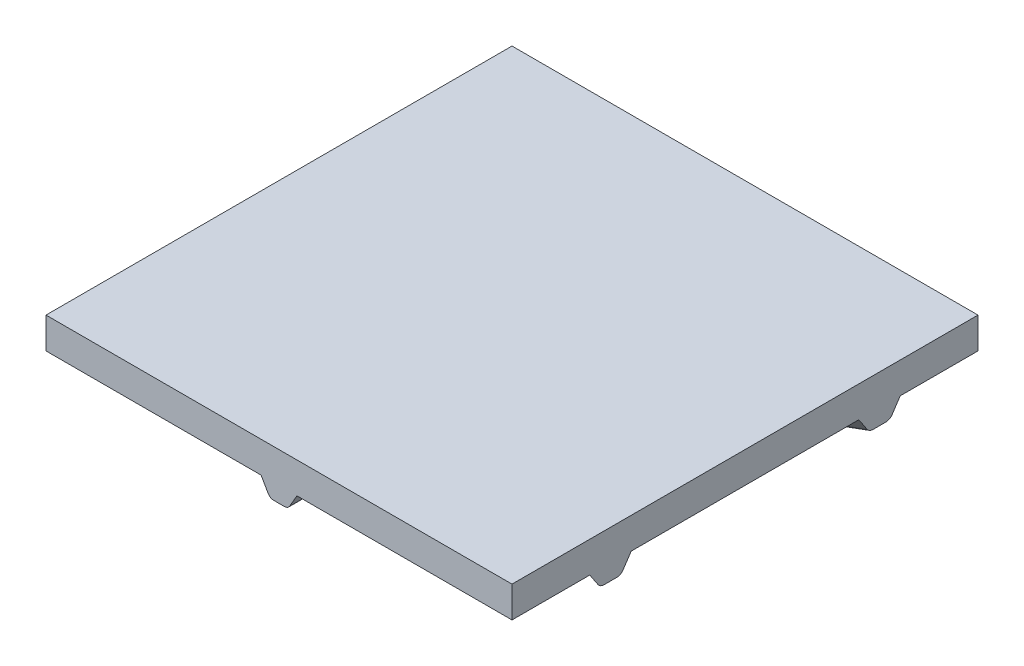
from build123d import *

# Parameters (mm, degrees)
HEXAGON_DEPTH = 20
HEXAGON_DRAFT = -20.000000000000043
BASE_DEPTH    = 10
SMALL_DEPTH   = 75
FILLET_2_R    = 3
ARRAY_START   = -102.451905284
ARRAY_DEPTH   = 204.903810568
ARRAY_2_DEPTH = 204.903810568
ARRAY_START_2 = 45.459553514
ARRAY_3_DEPTH = 29.540446486
FILLET2_R     = 2
CROQUIS4_W    = 26.916537621276092
CROQUIS4_H    = 24.058782859612524
CROQUIS4_W_2  = 36.99619518821565
CROQUIS4_H_2  = 32.17850701075816
TRIM_DEPTH    = 179.30560151606045


# Read off the part's stored shape, not the designer's step: array
with BuildPart() as part:
    # Croquis1 → hexagon (with draft: the straight prism first)
    with BuildSketch(Plane(origin=(0, 0, 0), x_dir=(1, 0, 0), z_dir=(0, 1, 0))):
        Polygon((46.18802153516988, 0), (23.09401076758485, 39.9999999999999), (-23.09401076758513, 39.99999999999974), (-46.18802153516988, -3.2253e-13), (-23.09401076758457, -40.00000000000006), (23.09401076758541, -39.99999999999958), align=None)
    extrude(amount=HEXAGON_DEPTH)
    # hexagon: the draft: its side faces are tilted about the plane it starts from
    hexagon_sides = [part.faces().sort_by_distance(p)[0] for p in [
        (34.641016151, 10, -20),
        (0, 10, -40),
        (-34.641016151, 10, -20),
        (-34.641016151, 10, 20),
        (0, 10, 40),
        (34.641016151, 10, 20),
    ]]
    draft(hexagon_sides, Plane(origin=(0, 0, 0), x_dir=(1, 0, 0), z_dir=(0, 1, 0)), HEXAGON_DRAFT)

    # Croquis2 → base (add)
    with BuildSketch(Plane(origin=(0, 20, 0), x_dir=(1, 0, 0), z_dir=(0, 1, 0))):
        Polygon((74.99999999999999, -74.99999999999999), (-75.00000000000001, -75.00000000000001), (-75.00000000000001, 74.99999999999999), (74.99999999999999, 75.00000000000001), align=None)
    extrude(amount=BASE_DEPTH)

    # Croquis3 → small (add, through all)
    with BuildSketch(Plane.XY):
        Polygon((-5.773502691896257, 20), (-2.886751345948127, 15), (2.886751345948127, 15), (5.7735026918962555, 20), (2.8867513459481215, 25.000000000000007), (-2.8867513459481278, 25.000000000000007), align=None)
    extrude(amount=-SMALL_DEPTH)

    # fillet 2
    fillet_2_edges = [part.edges().sort_by_distance(p)[0] for p in [
        (4.2277e-13, 0, 39.99999999999982),
        (-34.64101615137723, 0, 20.000000000000206),
        (-34.641016151377514, 0, -19.9999999999997),
        (-1.4921e-13, 0, -39.999999999999815),
        (34.641016151377364, 0, -19.999999999999957),
        (34.64101615137765, 0, 19.999999999999787),
    ]]
    fillet(fillet_2_edges, radius=FILLET_2_R)

    # array outline → array (add)
    with BuildSketch(Plane(origin=(0, 0, 0), x_dir=(0.500000000000004, 0, -0.8660254037844363), z_dir=(0.8660254037844363, 0, 0.5000000000000042)).offset(ARRAY_START)):
        Polygon((-5.773502692, 20), (-2.886751346, 15), (2.886751346, 15), (5.773502692, 20), (2.886751346, 25), (-2.886751346, 25), align=None)
    extrude(amount=ARRAY_DEPTH)

    # array 2 outline → array 2 (add)
    with BuildSketch(Plane(origin=(0, 0, 0), x_dir=(0.49999999999999767, 0, 0.86602540378444), z_dir=(0.8660254037844399, 0, -0.49999999999999795)).offset(ARRAY_START)):
        Polygon((5.773502692, -20), (2.886751346, -15), (-2.886751346, -15), (-5.773502692, -20), (-2.886751346, -25), (2.886751346, -25), align=None)
    extrude(amount=ARRAY_2_DEPTH)

    # array 3 outline → array 3 (add)
    with BuildSketch(Plane.XY.offset(ARRAY_START_2)):
        Polygon((-5.773502692, 20), (-2.886751346, 15), (2.886751346, 15), (5.773502692, 20), align=None)
    extrude(amount=ARRAY_3_DEPTH)

    # fillet2
    fillet2_edges = [part.edges().sort_by_distance(p)[0] for p in [
        (-2.886751346, 15, 60.229776756999996),
        (62.604164741938675, 15, -39.477864699543005),
        (65.49091608793843, 15, 34.47786469945364),
        (-62.60416474193839, 15, -39.477864699543446),
        (2.886751346, 15, 60.229776756999996),
        (-62.60416474193865, 15, 39.47786469954298),
        (-65.49091608793839, 15, -34.47786469945361),
        (2.886751345948127, 15, -60.22977675699644),
        (-2.886751345948127, 15, -60.22977675699643),
        (62.60416474193845, 15, 39.47786469954348),
        (65.49091608793866, 15, -34.47786469945315),
        (-65.49091608793867, 15, 34.47786469945314),
    ]]
    fillet(fillet2_edges, radius=FILLET2_R)

    # Croquis4 → trim (cut, through all)
    with BuildSketch(Plane(origin=(-1.388e-14, 0, -75), x_dir=(-1, 0, 1.9e-16), z_dir=(-1.9e-16, 0, -1))):
        with Locations((-88.45826881063805, 17.97060857019374)):
            Rectangle(CROQUIS4_W, CROQUIS4_H)
        with Locations((93.49809759410783, 13.910746494620925)):
            Rectangle(CROQUIS4_W_2, CROQUIS4_H_2)
    extrude(amount=-TRIM_DEPTH, mode=Mode.SUBTRACT)


solid = part.part
